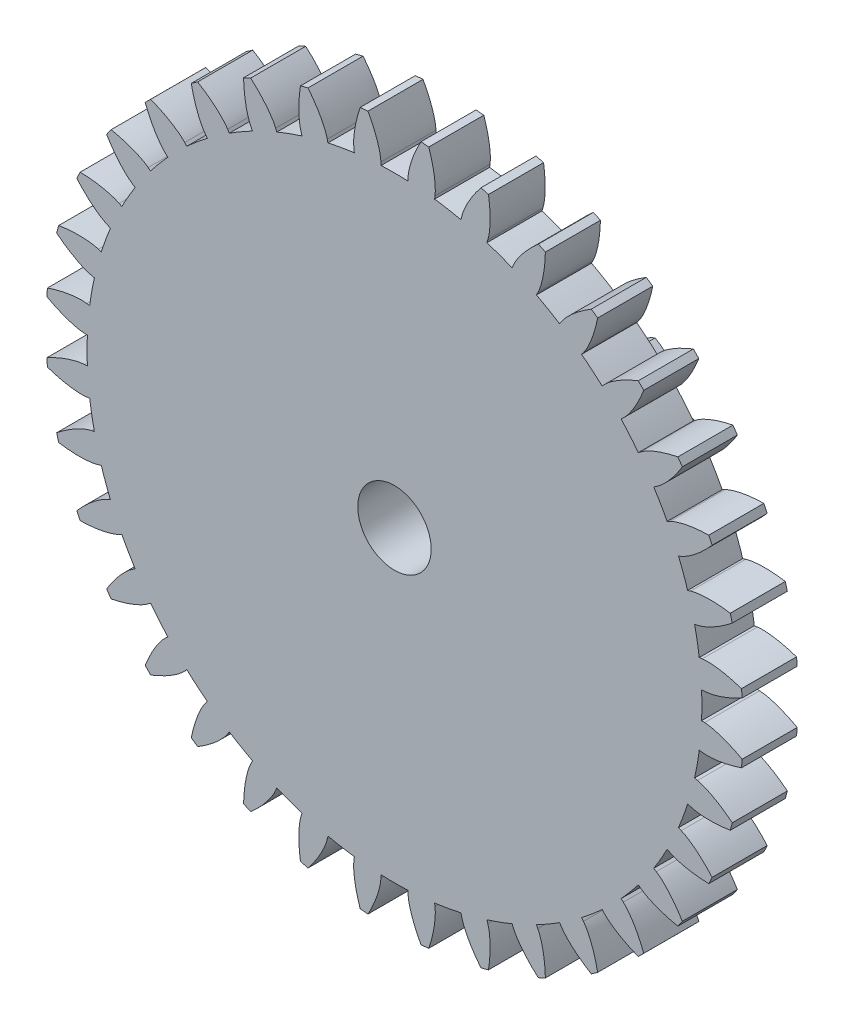
from build123d import *

# Parameters (mm, degrees)
SKETCH_1_R               = 3
SKETCH_1_R_2             = 1
EXTRUDE_1_DEPTH          = 4
CUT_EXTRUDE_1_DEPTH      = 6.830951895
PATTERN_CIRCULAR_1_COUNT = 10
PATTERN_CIRCULAR_1_ANGLE = 324
SKETCH_2_R               = 9.5
SKETCH_2_R_2             = 1
EXTRUDE_2_DEPTH          = 1.5
CUT_EXTRUDE_3_DEPTH      = 15.017845933
PATTERN_CIRCULAR_2_COUNT = 36


with BuildPart() as part:
    # 草图1 → 凸台-拉伸1 (new body)
    with BuildSketch(Plane.XY):
        Circle(SKETCH_1_R)
        Circle(SKETCH_1_R_2, mode=Mode.SUBTRACT)
    extrude(amount=EXTRUDE_1_DEPTH)

    # 草图1<3> → 切除-拉伸1 (cut, through all)
    with BuildSketch(Plane.XY):
        with BuildLine():
            Line((2.32404424, 0.34308491), (1.854897167, 0.273827502))
            ThreePointArc((1.854897167, 0.273827502), (1.869967538, 0.137282213), (1.875, 0))
            ThreePointArc((1.875, 0), (1.869967538, -0.137282213), (1.854897167, -0.273827502))
            Line((1.854897167, -0.273827502), (2.32404424, -0.34308491))
            add(Edge.make_bspline(
                [(2.32404424, -0.34308491), (2.341759801, -0.345700154), (2.390654467, -0.356680366), (2.480003701, -0.392068726), (2.61555699, -0.468743726), (2.742843787, -0.569725263), (2.835064857, -0.660865824), (2.891013955, -0.723601117), (2.906804856, -0.741947122)],
                knots=[0, 0, 0, 0, 0, 0.005604068, 0.015718248, 0.029959916, 0.048733667, 0.056327581, 0.056327581, 0.056327581, 0.056327581, 0.056327581], degree=4))
            ThreePointArc((2.906804856, -0.741947122), (2.976610032, -0.373888642), (3, 0))
            ThreePointArc((3, 0), (2.976610032, 0.373888642), (2.906804856, 0.741947122))
            add(Edge.make_bspline(
                [(2.32404424, 0.34308491), (2.341759801, 0.345700154), (2.390654467, 0.356680366), (2.480003701, 0.392068726), (2.61555699, 0.468743726), (2.742843787, 0.569725263), (2.835064857, 0.660865824), (2.891013955, 0.723601117), (2.906804856, 0.741947122)],
                knots=[0, 0, 0, 0, 0, 0.005604068, 0.015718248, 0.029959916, 0.048733667, 0.056327581, 0.056327581, 0.056327581, 0.056327581, 0.056327581], degree=4))
        make_face()
    cut_extrude_1 = extrude(amount=CUT_EXTRUDE_1_DEPTH, mode=Mode.SUBTRACT)

    # 阵列(圆周)1: 切除-拉伸1 ×10 about axis
    pattern_circular_1_axis = Axis((0, 0, 4), (0, 0, 1))
    for i in range(1, PATTERN_CIRCULAR_1_COUNT):
        add(cut_extrude_1.rotate(pattern_circular_1_axis, i * PATTERN_CIRCULAR_1_ANGLE / (PATTERN_CIRCULAR_1_COUNT - 1)), mode=Mode.SUBTRACT)

    # 草图2 → 凸台-拉伸2 (add)
    with BuildSketch(Plane.XY.offset(4)):
        Circle(SKETCH_2_R)
        Circle(SKETCH_2_R_2, mode=Mode.SUBTRACT)
    extrude(amount=EXTRUDE_2_DEPTH)

    # 草图2<3> → 切除-拉伸3 (cut, through all)
    with BuildSketch(Plane.XY.offset(4)):
        with BuildLine():
            Line((8.449184175, 0.368899348), (8.367028856, 0.365312369))
            ThreePointArc((8.367028856, 0.365312369), (8.373006977, 0.182699662), (8.375, 0))
            ThreePointArc((8.375, 0), (8.373006977, -0.182699662), (8.367028856, -0.365312369))
            Line((8.367028856, -0.365312369), (8.449184175, -0.368899348))
            add(Edge.make_bspline(
                [(8.449184175, -0.368899348), (8.48135304, -0.370303871), (8.545384789, -0.376123838), (8.723256636, -0.408187544), (8.9845289, -0.488395362), (9.20619115, -0.582736422), (9.391692349, -0.677616081), (9.472530074, -0.721923815)],
                knots=[0, 0, 0, 0, 0, 0.002802034, 0.005604068, 0.015718248, 0.023749817, 0.023749817, 0.023749817, 0.023749817, 0.023749817], degree=4))
            ThreePointArc((9.472530074, -0.721923815), (9.493130035, -0.361223128), (9.5, 0))
            ThreePointArc((9.5, 0), (9.493130035, 0.361223128), (9.472530074, 0.721923815))
            add(Edge.make_bspline(
                [(8.449184175, 0.368899348), (8.48135304, 0.370303871), (8.545384789, 0.376123838), (8.723256636, 0.408187544), (8.9845289, 0.488395362), (9.20619115, 0.582736422), (9.391692349, 0.677616081), (9.472530074, 0.721923815)],
                knots=[0, 0, 0, 0, 0, 0.002802034, 0.005604068, 0.015718248, 0.023749817, 0.023749817, 0.023749817, 0.023749817, 0.023749817], degree=4))
        make_face()
    cut_extrude_3 = extrude(amount=CUT_EXTRUDE_3_DEPTH, mode=Mode.SUBTRACT)

    # 阵列(圆周)2: 切除-拉伸3 ×36 about axis
    pattern_circular_2_axis = Axis((0, 0, 5.5), (0, 0, 1))
    for i in range(1, PATTERN_CIRCULAR_2_COUNT):
        add(cut_extrude_3.rotate(pattern_circular_2_axis, i * 360 / PATTERN_CIRCULAR_2_COUNT), mode=Mode.SUBTRACT)


solid = part.part
